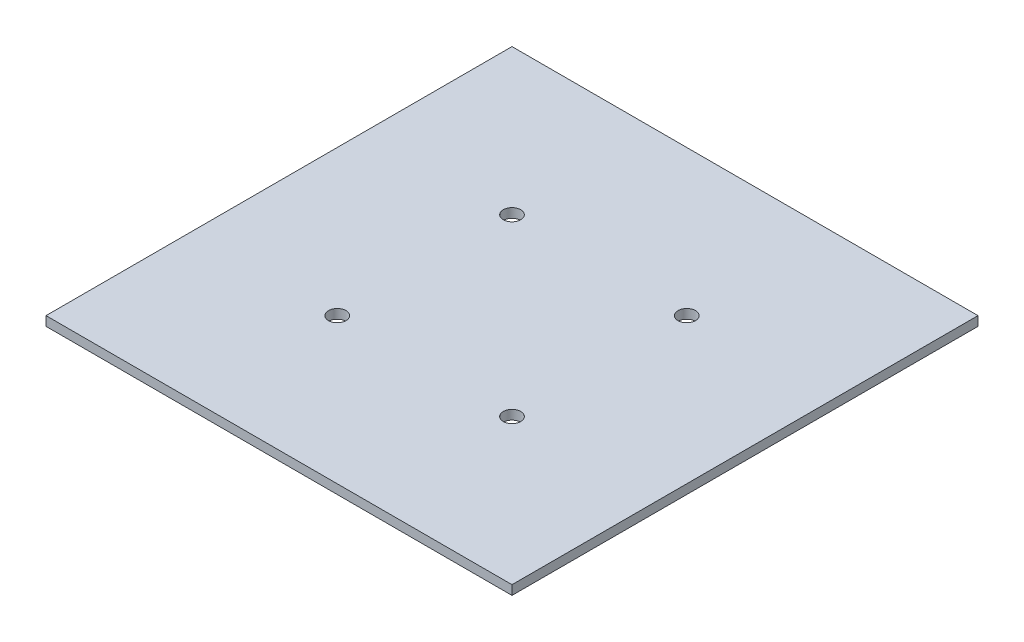
from build123d import *

# Parameters (mm, degrees)
ESQUISSE1_W      = 80
ESQUISSE1_H      = 80
ESQUISSE1_R      = 1.5
EXTRUSION1_DEPTH = 1.6


with BuildPart() as part:
    # Esquisse1 → Extrusion1 (new body)
    with BuildSketch(Plane(origin=(0, 0, 0), x_dir=(1, 0, 0), z_dir=(0, 1, 0))):
        Rectangle(ESQUISSE1_W, ESQUISSE1_H)
        with Locations((15, 15)):
            Circle(ESQUISSE1_R, mode=Mode.SUBTRACT)
        with Locations((-15, 15)):
            Circle(ESQUISSE1_R, mode=Mode.SUBTRACT)
        with Locations((15, -15)):
            Circle(ESQUISSE1_R, mode=Mode.SUBTRACT)
        with Locations((-15, -15)):
            Circle(ESQUISSE1_R, mode=Mode.SUBTRACT)
    extrude(amount=EXTRUSION1_DEPTH)


solid = part.part
